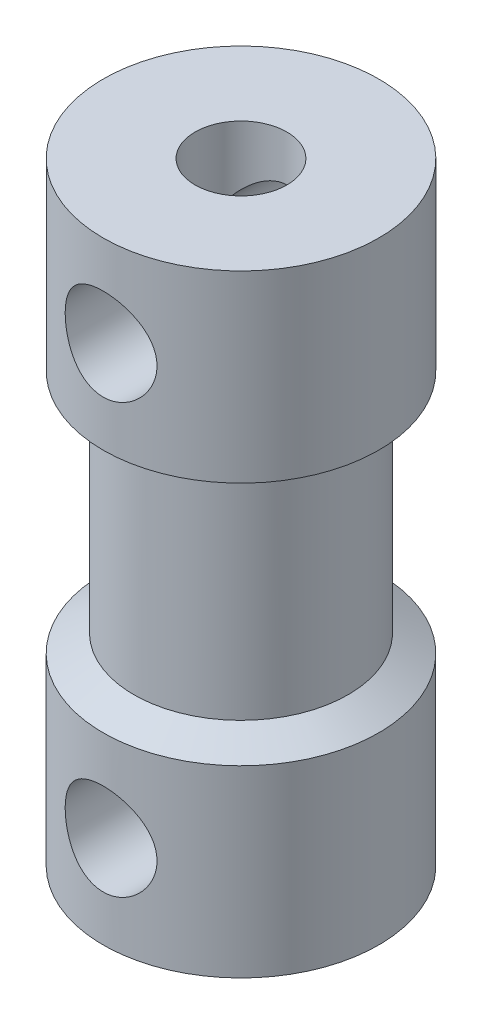
from build123d import *

# Parameters (mm, degrees)
SKETCH_1_R               = 3.5
EXTRUDE_1_DEPTH          = 20
SKETCH_2_R               = 1.5
CUT_EXTRUDE_1_DEPTH      = 10
SKETCH_3_R               = 1
CUT_EXTRUDE_2_DEPTH      = 10
SKETCH_4_R               = 4.5
SKETCH_4_R_2             = 3.5
EXTRUDE_2_DEPTH          = 6
EXTRUDE_START            = -6
SKETCH_5_R               = 4.5
SKETCH_5_R_2             = 3.5
EXTRUDE_3_DEPTH          = 6
CHAMFER_1_SIZE           = 0.58
CHAMFER_1_SIZE_2         = 1.004589468
CUT_EXTRUDE_3_DEPTH      = 21.988091862
CUT_EXTRUDE_3_DEPTH_BACK = 21.988091862
SKETCH_6_R               = 1.5


with BuildPart() as part:
    # 草圖1 → 填料-伸長1 (new body)
    with BuildSketch(Plane(origin=(0, 0, 0), x_dir=(1, 0, 0), z_dir=(0, 1, 0))):
        with Locations(Location((0, 0, 0), (0, 0, 270))):
            Circle(SKETCH_1_R)
    extrude(amount=EXTRUDE_1_DEPTH)

    # 草圖2 → 除料-伸長1 (cut)
    with BuildSketch(Plane(origin=(0, 20, 0), x_dir=(1, 0, 0), z_dir=(0, 1, 0))):
        with Locations(Location((0, 0, 0), (0, 0, 270))):
            Circle(SKETCH_2_R)
    extrude(amount=-CUT_EXTRUDE_1_DEPTH, mode=Mode.SUBTRACT)

    # 草圖3 → 除料-伸長2 (cut)
    with BuildSketch(Plane.XZ):
        with Locations(Location((0, 0, 0), (0, 0, 270))):
            Circle(SKETCH_3_R)
    extrude(amount=-CUT_EXTRUDE_2_DEPTH, mode=Mode.SUBTRACT)

    # 草圖4 → 填料-伸長2 (add)
    with BuildSketch(Plane.XZ):
        with Locations(Location((0, 0, 0), (0, 0, 270))):
            Circle(SKETCH_4_R)
        with Locations(Location((0, 0, 0), (0, 0, 270))):
            Circle(SKETCH_4_R_2, mode=Mode.SUBTRACT)
    extrude(amount=-EXTRUDE_2_DEPTH)

    # 草圖5 → 填料-伸長3 (add)
    with BuildSketch(Plane(origin=(0, 20, 0), x_dir=(1, 0, 0), z_dir=(0, 1, 0)).offset(EXTRUDE_START)):
        with Locations(Location((0, 0, 0), (0, 0, 90))):
            Circle(SKETCH_5_R)
        with Locations(Location((0, 0, 0), (0, 0, 90))):
            Circle(SKETCH_5_R_2, mode=Mode.SUBTRACT)
    extrude(amount=EXTRUDE_3_DEPTH)

    # 導角1
    # the kernel refuses this chamfer: 1.004589468, 0.58 mm, written as the material it adds along each edge
    with BuildSketch(Plane(origin=(0, 14, 0), x_dir=(0, 0, 1), z_dir=(1, 0, 0))) as chamfer_1_piece_1_section:
        Polygon((3.5, CHAMFER_1_SIZE), (3.5 + CHAMFER_1_SIZE_2, 0), (3.5, 0), align=None)
    chamfer_1_piece_1 = revolve(axis=Axis((0, 14, 0), (0, -1, 0)), mode=Mode.PRIVATE)
    chamfer_1_piece_1 = chamfer_1_piece_1 & Plane(origin=(0, 13.715905857, 0), x_dir=(0, 0, -1), z_dir=(0, -1, 0)) * Cylinder(4.5, 19, mode=Mode.PRIVATE)
    add(chamfer_1_piece_1)
    with BuildSketch(Plane(origin=(0, 6, 0), x_dir=(0, 0, 1), z_dir=(-1, 0, 0))) as chamfer_1_piece_2_section:
        Polygon((3.5, CHAMFER_1_SIZE), (3.5 + CHAMFER_1_SIZE_2, 0), (3.5, 0), align=None)
    chamfer_1_piece_2 = revolve(axis=Axis((0, 6, 0), (0, 1, 0)), mode=Mode.PRIVATE)
    chamfer_1_piece_2 = chamfer_1_piece_2 & Plane(origin=(0, 6.284094143, 0), x_dir=(0, 0, -1), z_dir=(0, -1, 0)) * Cylinder(4.5, 19, mode=Mode.PRIVATE)
    add(chamfer_1_piece_2)

    # 草圖6 → 除料-伸長3 (cut, two sides: drawn at the far end of the back side and taken through both)
    with BuildSketch(Plane.XY.offset(-CUT_EXTRUDE_3_DEPTH_BACK)):
        with Locations((0, 17)):
            Circle(SKETCH_6_R)
        with Locations((0, 3)):
            Circle(SKETCH_6_R)
    extrude(amount=CUT_EXTRUDE_3_DEPTH + CUT_EXTRUDE_3_DEPTH_BACK, mode=Mode.SUBTRACT)


solid = part.part
